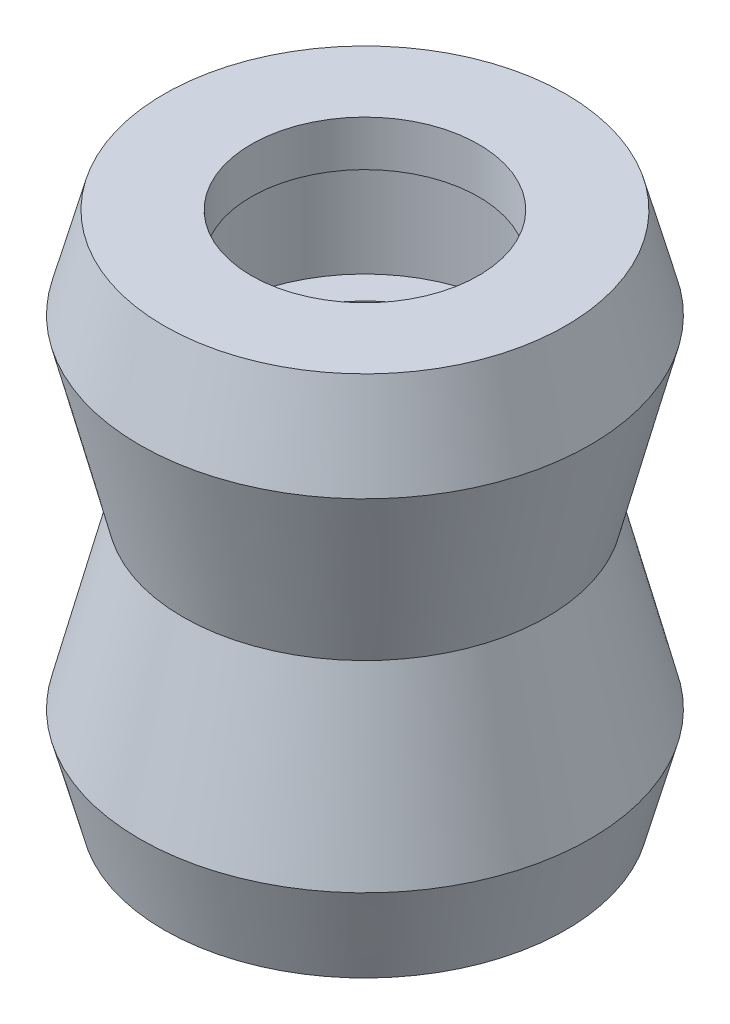
from build123d import *


with BuildPart() as part:
    # Sketch1 → Revolve1 (revolve)
    with BuildSketch(Plane.XY):
        Polygon((5, 11.5), (5, 9.5), (6.45, 9.5), (6.45, 4.5), (5, 4.5), (5, 0), (8, 0), (9.9, 7.5), (8.82820323, 11.5), align=None)
    revolve1 = revolve(axis=Axis((0, 11.727044646, 0), (0, -1, 0)))

    # Mirror1: Revolve1 across plane
    add(revolve1.mirror(Plane(origin=(5, 0, 0), x_dir=(0, 0, 1), z_dir=(0, 1, 0))))

    # Mirror2: Revolve1 across plane
    add(revolve1.mirror(Plane.ZX))


solid = part.part
